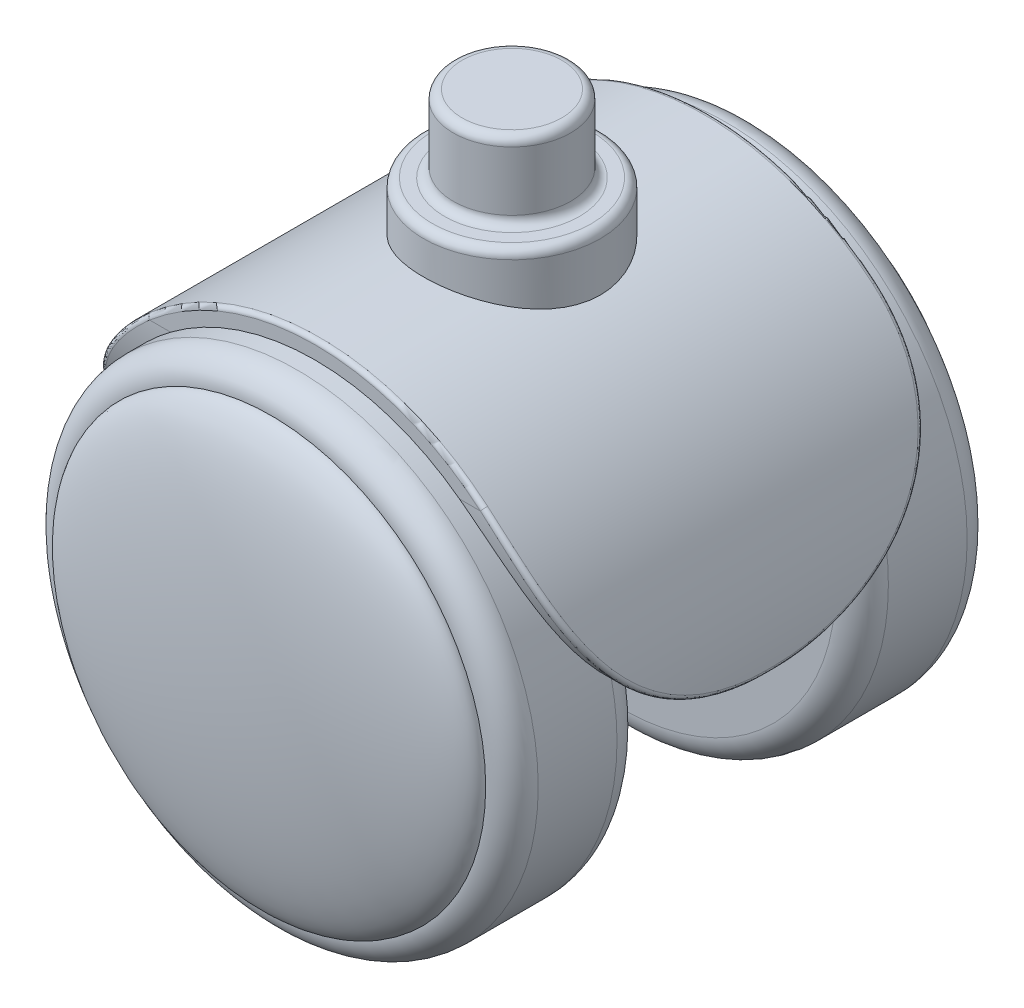
from build123d import *

# Parameters (mm, degrees)
SKETCH1_R           = 27.5
BOSS_EXTRUDE1_DEPTH = 15
FILLET1_R           = 3
DOME1_FACE_RADIUS   = 24.5
DOME1_HEIGHT        = 5
BOSS_EXTRUDE2_DEPTH = 22.5
FILLET2_START       = -31
FILLET2_DEPTH       = 61
FILLET3_R           = 0.5
SKETCH6_R           = 4.781289059
CUT_EXTRUDE1_DEPTH  = 7.5
SKETCH6_2_R         = 4.781289059
BOSS_EXTRUDE3_DEPTH = 12.5


with BuildPart() as part:
    # Sketch1 → Boss-Extrude1 (new body)
    with BuildSketch(Plane.XY):
        Circle(SKETCH1_R)
    extrude(amount=BOSS_EXTRUDE1_DEPTH)

    # Fillet1
    fillet1_edges = [part.edges().sort_by_distance(p)[0] for p in [
        (-27.5, 0, 0),
        (-27.5, 0, 15),
    ]]
    fillet(fillet1_edges, radius=FILLET1_R)

    # Dome1: an elliptical dome of height H over a round flat face of radius A is half a spheroid: the quarter ellipse of half axes A and H revolved about the face's axis
    with BuildSketch(Plane((0, 0, 15), x_dir=(0, 1, 0), z_dir=(1, 0, 0)), mode=Mode.PRIVATE) as dome1_quarter:
        Ellipse(DOME1_FACE_RADIUS, DOME1_HEIGHT)
        Rectangle(DOME1_FACE_RADIUS, DOME1_HEIGHT, align=(Align.MIN, Align.MIN), mode=Mode.INTERSECT)
    revolve(dome1_quarter.sketch, axis=Axis((0, 0, 15), (0, 0, 1)))


with BuildPart() as body_2:
    # Mirror2: mirrored copy
    add(part.part.mirror(Plane.XY.offset(-12.5)))


with BuildPart() as body_3:
    # Sketch4 → Boss-Extrude2 (new, symmetric)
    with BuildSketch(Plane.XY.offset(-12.5)):
        with BuildLine():
            Line((-29.5, 0), (-27.5, 0))
            ThreePointArc((-27.5, 0), (0, 27.5), (27.5, 0))
            Line((27.5, 0), (29.5, 0))
            ThreePointArc((29.5, 0), (0, 29.5), (-29.5, 0))
        make_face()
    extrude(amount=BOSS_EXTRUDE2_DEPTH, both=True)

    # Fillet2: read off the stored shape, not the designer's step
    # Fillet2 outline → Fillet2 (cut)
    with BuildSketch(Plane.YZ.offset(FILLET2_START)):
        with BuildLine():
            Line((0, 10), (0, -12))
            ThreePointArc((0, -12), (6.443650814, 3.556349186), (22, 10))
            Line((22, 10), (0, 10))
        make_face()
        with BuildLine():
            ThreePointArc((22, -35), (6.443650814, -28.556349186), (0, -13))
            Line((0, -13), (0, -35))
            Line((0, -35), (22, -35))
        make_face()
    extrude(amount=FILLET2_DEPTH, mode=Mode.SUBTRACT)

    # Fillet3
    fillet3_edges = [body_3.edges().sort_by_distance(p)[0] for p in [
        (0, 29.5, 10),
        (0, 29.5, -35),
        (-29.5, 0, -12.5),
        (29.5, 0, -12.5),
        (-28.558847105, 7.392039778, -29.450151918),
        (-28.558847105, 7.392039777, 4.450151918),
        (28.558847104, 7.392039777, -29.450151918),
        (28.558847104, 7.392039777, 4.450151918),
    ]]
    fillet(fillet3_edges, radius=FILLET3_R)

    # Sketch5 → Cut-Revolve1 (revolve, cut)
    with BuildSketch(Plane.XY.offset(-12.5)):
        with BuildLine():
            Line((6.701272053, -8.196436933), (6.701272053, 20.500385656))
            ThreePointArc((6.701272053, 20.500385656), (6.994165272, 21.207492437), (7.701272053, 21.500385656))
            Line((7.701272053, 21.500385656), (9.098941198, 21.500385656))
            ThreePointArc((9.098941198, 21.500385656), (9.806047979, 21.793278875), (10.098941198, 22.500385656))
            Line((10.098941198, 22.500385656), (10.098941198, 33.289669881))
            ThreePointArc((10.098941198, 33.289669881), (9.806047979, 33.996776663), (9.098941198, 34.289669881))
            Line((9.098941198, 34.289669881), (7.701272053, 34.289669881))
            ThreePointArc((7.701272053, 34.289669881), (6.994165272, 34.5825631), (6.701272053, 35.289669881))
            Line((6.701272053, 35.289669881), (6.701272053, 42.048208581))
            ThreePointArc((6.701272053, 42.048208581), (6.408378834, 42.755315362), (5.701272053, 43.048208581))
            Line((5.701272053, 43.048208581), (0, 43.048208581))
            Line((0, 43.048208581), (0, 0))
            Line((0, 0), (0, -9.196436933))
            Line((0, -9.196436933), (5.701272053, -9.196436933))
            ThreePointArc((5.701272053, -9.196436933), (6.408378834, -8.903543714), (6.701272053, -8.196436933))
        make_face()
    revolve(axis=Axis((0, 0, -12.5), (0, 1, 0)), mode=Mode.SUBTRACT)

    # Sketch5<2> → Revolve2 (revolve)
    with BuildSketch(Plane.XY.offset(-12.5)):
        with BuildLine():
            Line((6.701272053, -8.196436933), (6.701272053, 20.500385656))
            ThreePointArc((6.701272053, 20.500385656), (6.994165272, 21.207492437), (7.701272053, 21.500385656))
            Line((7.701272053, 21.500385656), (9.098941198, 21.500385656))
            ThreePointArc((9.098941198, 21.500385656), (9.806047979, 21.793278875), (10.098941198, 22.500385656))
            Line((10.098941198, 22.500385656), (10.098941198, 33.289669881))
            ThreePointArc((10.098941198, 33.289669881), (9.806047979, 33.996776663), (9.098941198, 34.289669881))
            Line((9.098941198, 34.289669881), (7.701272053, 34.289669881))
            ThreePointArc((7.701272053, 34.289669881), (6.994165272, 34.5825631), (6.701272053, 35.289669881))
            Line((6.701272053, 35.289669881), (6.701272053, 42.048208581))
            ThreePointArc((6.701272053, 42.048208581), (6.408378834, 42.755315362), (5.701272053, 43.048208581))
            Line((5.701272053, 43.048208581), (0, 43.048208581))
            Line((0, 43.048208581), (0, 0))
            Line((0, 0), (0, -9.196436933))
            Line((0, -9.196436933), (5.701272053, -9.196436933))
            ThreePointArc((5.701272053, -9.196436933), (6.408378834, -8.903543714), (6.701272053, -8.196436933))
        make_face()
    revolve(axis=Axis((0, 0, -12.5), (0, 1, 0)))

    # Sketch6 → Cut-Extrude1 (cut, symmetric)
    with BuildSketch(Plane.XY.offset(-12.5)):
        Circle(SKETCH6_R)
    extrude(amount=CUT_EXTRUDE1_DEPTH, both=True, mode=Mode.SUBTRACT)


with BuildPart() as part_1:
    add(part.part)

    add(body_2.part)  # Boss-Extrude3 merges body 2

    add(body_3.part)  # Boss-Extrude3 merges body 3
    # Sketch6<2> → Boss-Extrude3 (add, symmetric)
    with BuildSketch(Plane.XY.offset(-12.5)):
        Circle(SKETCH6_2_R)
    extrude(amount=BOSS_EXTRUDE3_DEPTH, both=True)


solid = part_1.part
